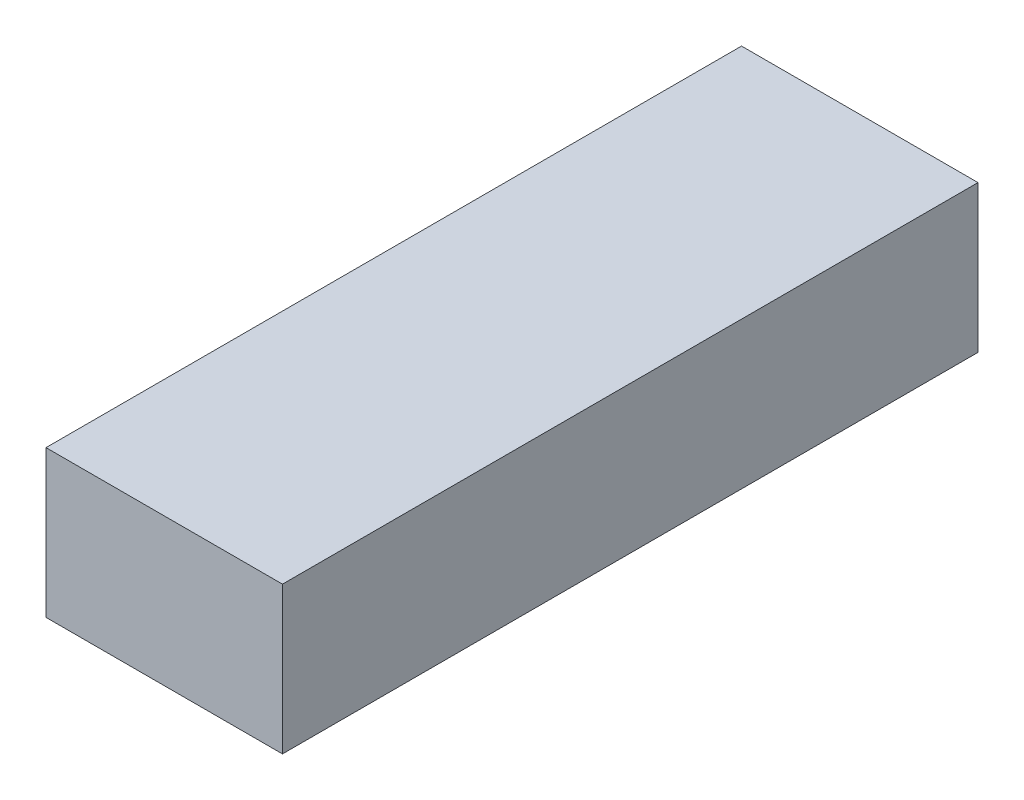
from build123d import *

# Parameters (mm, degrees)
SKETCH1_W           = 11.9
SKETCH1_H           = 35
SKETCH1_W_2         = 7.9
SKETCH1_H_2         = 7.9
BOSS_EXTRUDE1_DEPTH = 2.8
SKETCH2_W           = 11.9
SKETCH2_H           = 35
SKETCH2_W_2         = 6.9
SKETCH2_H_2         = 28.1
BOSS_EXTRUDE2_DEPTH = 3
SKETCH3_W           = 11.9
SKETCH3_H           = 35
BOSS_EXTRUDE3_DEPTH = 1.6
CUT_EXTRUDE1_DEPTH  = 6.8


with BuildPart() as part:
    # Sketch1 → Boss-Extrude1 (new body)
    with BuildSketch(Plane(origin=(0, 0, 0), x_dir=(1, 0, 0), z_dir=(0, 1, 0))):
        with Locations((0, 9.15)):
            Rectangle(SKETCH1_W, SKETCH1_H)
        Rectangle(SKETCH1_W_2, SKETCH1_H_2, mode=Mode.SUBTRACT)
    extrude(amount=BOSS_EXTRUDE1_DEPTH)

    # Sketch2 → Boss-Extrude2 (add)
    with BuildSketch(Plane(origin=(0, 2.8, 0), x_dir=(1, 0, 0), z_dir=(0, 1, 0))):
        with Locations((0, 9.15)):
            Rectangle(SKETCH2_W, SKETCH2_H)
        with Locations((0, 10.6)):
            Rectangle(SKETCH2_W_2, SKETCH2_H_2, mode=Mode.SUBTRACT)
    extrude(amount=BOSS_EXTRUDE2_DEPTH)

    # Sketch3 → Boss-Extrude3 (add)
    with BuildSketch(Plane(origin=(0, 5.8, 0), x_dir=(1, 0, 0), z_dir=(0, 1, 0))):
        with Locations((0, 9.15)):
            Rectangle(SKETCH3_W, SKETCH3_H)
    extrude(amount=BOSS_EXTRUDE3_DEPTH)

    # Sketch4 → Cut-Extrude1 (cut)
    with BuildSketch(Plane(origin=(0, -8.565144899, -3.117457795), x_dir=(-1, 0, 0), z_dir=(0, -0.9396926207859081, -0.34202014332566943))):
        with BuildLine():
            ThreePointArc((4.114090909, 18.618006757), (3.825, 18.917808344), (4.114090909, 19.217609931))
            ThreePointArc((4.114090909, 19.217609931), (2.916815472, 21.834623816), (0.299801587, 23.031899253))
            ThreePointArc((0.299801587, 23.031899253), (0, 22.742808344), (-0.299801587, 23.031899253))
            ThreePointArc((-0.299801587, 23.031899253), (-2.916815472, 21.834623816), (-4.114090909, 19.217609931))
            ThreePointArc((-4.114090909, 19.217609931), (-3.909045459, 19.126047717), (-3.825, 18.917808344))
            ThreePointArc((-3.825, 18.917808344), (-3.909045459, 18.709568971), (-4.114090909, 18.618006757))
            ThreePointArc((-4.114090909, 18.618006757), (-2.916815472, 16.000992872), (-0.299801587, 14.803717435))
            ThreePointArc((-0.299801587, 14.803717435), (0, 15.092808344), (0.299801587, 14.803717435))
            ThreePointArc((0.299801587, 14.803717435), (2.916815472, 16.000992872), (4.114090909, 18.618006757))
        make_face()
    extrude(amount=-CUT_EXTRUDE1_DEPTH, mode=Mode.SUBTRACT)


solid = part.part
